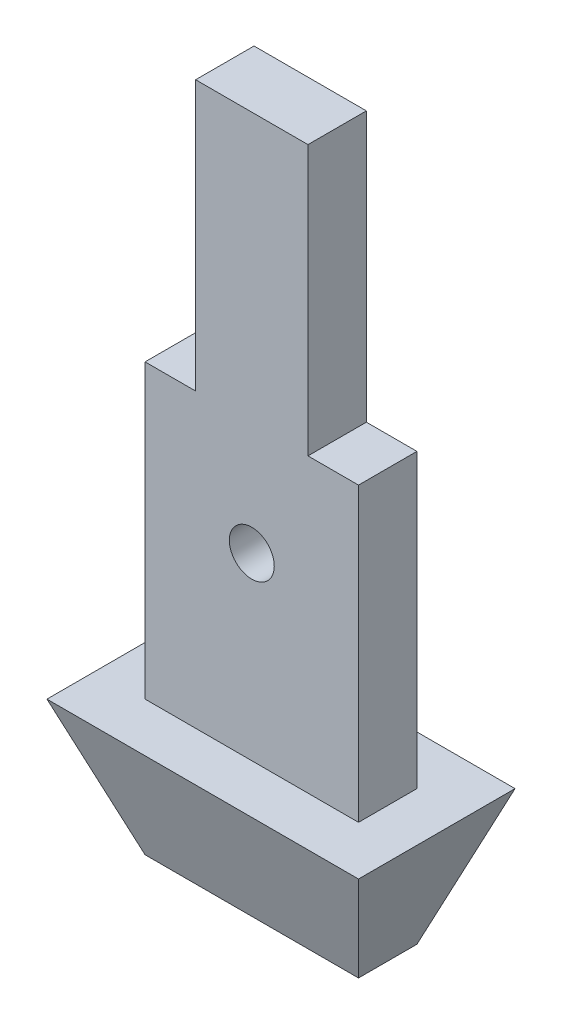
from build123d import *

# Parameters (mm, degrees)
ESBO_O1_R                = 1
RESSALTO_EXTRUS_O1_DEPTH = 2.6
ESBO_O2_W                = 9.5
ESBO_O2_H                = 2.6
RESSALTO_EXTRUS_O2_DEPTH = 6
RESSALTO_EXTRUS_O2_TAPER = -20


with BuildPart() as part:
    # Esboço1 → Ressalto-extrusão1 (new body)
    with BuildSketch(Plane.XY):
        Polygon((-2.5, 31), (2.5, 31), (2.5, 19), (4.75, 19), (4.75, 0), (-4.75, 0), (-4.75, 19), (-2.5, 19), align=None)
        with Locations((0, 14)):
            Circle(ESBO_O1_R, mode=Mode.SUBTRACT)
    extrude(amount=RESSALTO_EXTRUS_O1_DEPTH)

    # Esboço2 → Ressalto-extrusão2 (add)
    with BuildSketch(Plane.XZ):
        with Locations((0, 1.3)):
            Rectangle(ESBO_O2_W, ESBO_O2_H)
    extrude(amount=-RESSALTO_EXTRUS_O2_DEPTH, taper=RESSALTO_EXTRUS_O2_TAPER)


solid = part.part
